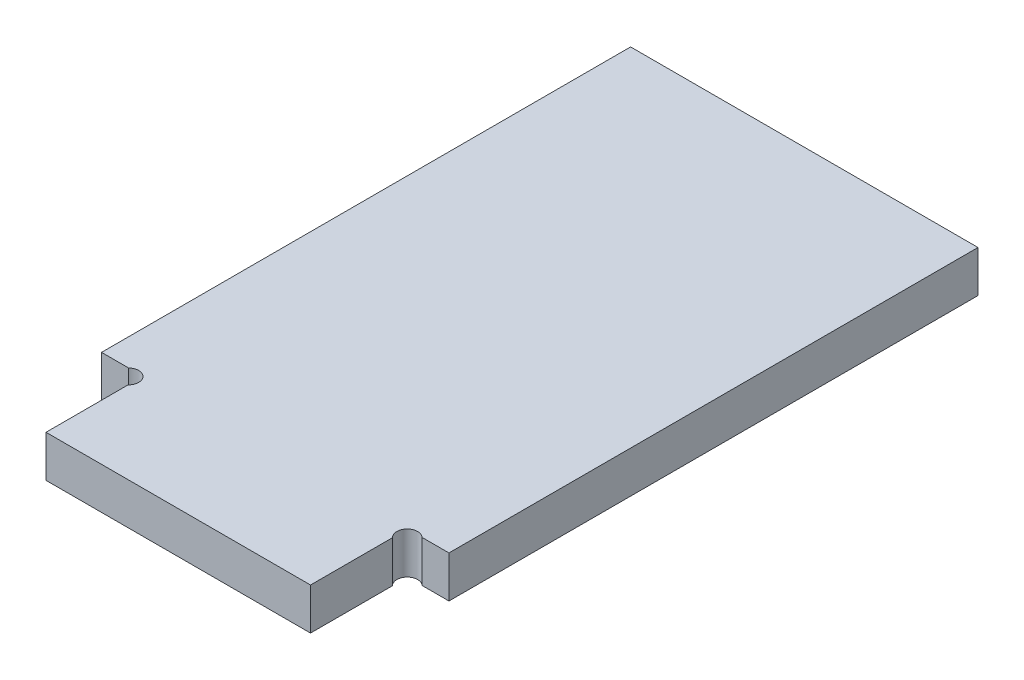
from build123d import *

# Parameters (mm, degrees)
BOSS_EXTRUDE1_DEPTH = 0.3


with BuildPart() as part:
    # Sketch1 → Boss-Extrude1 (new, symmetric)
    with BuildSketch(Plane(origin=(0, 0, 0), x_dir=(1, 0, 0), z_dir=(0, 1, 0))):
        with BuildLine():
            Line((-1.905, -0.215685766), (-1.905, -1.397))
            Line((-1.905, -1.397), (1.905, -1.397))
            Line((1.905, -1.397), (1.905, -0.215685766))
            ThreePointArc((1.905, -0.215685766), (1.901214467, -0.003785533), (2.113114701, 0))
            Line((2.113114701, 0), (2.5019, 0))
            Line((2.5019, 0), (2.5019, 7.62))
            Line((2.5019, 7.62), (-2.5019, 7.62))
            Line((-2.5019, 7.62), (-2.5019, 0))
            Line((-2.5019, 0), (-2.113114701, 0))
            ThreePointArc((-2.113114701, 0), (-1.901214467, -0.003785533), (-1.905, -0.215685766))
        make_face()
    extrude(amount=BOSS_EXTRUDE1_DEPTH, both=True)


solid = part.part
